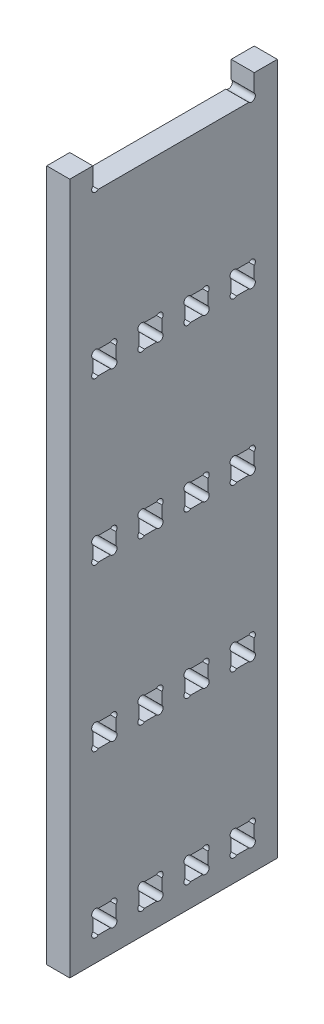
from build123d import *

# Parameters (mm, degrees)
BOSS_EXTRUDE1_DEPTH = 19.05


with BuildPart() as part:
    # Sketch8 → Boss-Extrude1 (new body)
    with BuildSketch(Plane(origin=(0, 0, 0), x_dir=(0, 0, -1), z_dir=(1, 0, 0))):
        with BuildLine():
            Line((0, -571.5), (0, 0))
            Line((0, 0), (-19.05, 0))
            Line((-19.05, 0), (-19.05, -14.559871939))
            ThreePointArc((-19.05, -14.559871939), (-19.05, -19.05), (-23.540128061, -19.05))
            Line((-23.540128061, -19.05), (-147.909871939, -19.05))
            ThreePointArc((-147.909871939, -19.05), (-152.4, -19.05), (-152.4, -14.559871939))
            Line((-152.4, -14.559871939), (-152.4, 0))
            Line((-152.4, 0), (-171.45, 0))
            Line((-171.45, 0), (-171.45, -571.5))
            Line((-171.45, -571.5), (0, -571.5))
        make_face()
        with BuildLine():
            Line((-152.4, -537.890128061), (-152.4, -547.959871939))
            ThreePointArc((-152.4, -547.959871939), (-152.4, -552.45), (-147.909871939, -552.45))
            Line((-147.909871939, -552.45), (-137.840128061, -552.45))
            ThreePointArc((-137.840128061, -552.45), (-133.35, -552.45), (-133.35, -547.959871939))
            Line((-133.35, -547.959871939), (-133.35, -537.890128061))
            ThreePointArc((-133.35, -537.890128061), (-133.35, -533.4), (-137.840128061, -533.4))
            Line((-137.840128061, -533.4), (-147.909871939, -533.4))
            ThreePointArc((-147.909871939, -533.4), (-152.4, -533.4), (-152.4, -537.890128061))
        make_face(mode=Mode.SUBTRACT)
        with BuildLine():
            Line((-114.3, -537.890128061), (-114.3, -547.959871939))
            ThreePointArc((-114.3, -547.959871939), (-114.3, -552.45), (-109.809871939, -552.45))
            Line((-109.809871939, -552.45), (-99.740128061, -552.45))
            ThreePointArc((-99.740128061, -552.45), (-95.25, -552.45), (-95.25, -547.959871939))
            Line((-95.25, -547.959871939), (-95.25, -537.890128061))
            ThreePointArc((-95.25, -537.890128061), (-95.25, -533.4), (-99.740128061, -533.4))
            Line((-99.740128061, -533.4), (-109.809871939, -533.4))
            ThreePointArc((-109.809871939, -533.4), (-114.3, -533.4), (-114.3, -537.890128061))
        make_face(mode=Mode.SUBTRACT)
        with BuildLine():
            Line((-76.2, -537.890128061), (-76.2, -547.959871939))
            ThreePointArc((-76.2, -547.959871939), (-76.2, -552.45), (-71.709871939, -552.45))
            Line((-71.709871939, -552.45), (-61.640128061, -552.45))
            ThreePointArc((-61.640128061, -552.45), (-57.15, -552.45), (-57.15, -547.959871939))
            Line((-57.15, -547.959871939), (-57.15, -537.890128061))
            ThreePointArc((-57.15, -537.890128061), (-57.15, -533.4), (-61.640128061, -533.4))
            Line((-61.640128061, -533.4), (-71.709871939, -533.4))
            ThreePointArc((-71.709871939, -533.4), (-76.2, -533.4), (-76.2, -537.890128061))
        make_face(mode=Mode.SUBTRACT)
        with BuildLine():
            Line((-38.1, -537.890128061), (-38.1, -547.959871939))
            ThreePointArc((-38.1, -547.959871939), (-38.1, -552.45), (-33.609871939, -552.45))
            Line((-33.609871939, -552.45), (-23.540128061, -552.45))
            ThreePointArc((-23.540128061, -552.45), (-19.05, -552.45), (-19.05, -547.959871939))
            Line((-19.05, -547.959871939), (-19.05, -537.890128061))
            ThreePointArc((-19.05, -537.890128061), (-19.05, -533.4), (-23.540128061, -533.4))
            Line((-23.540128061, -533.4), (-33.609871939, -533.4))
            ThreePointArc((-33.609871939, -533.4), (-38.1, -533.4), (-38.1, -537.890128061))
        make_face(mode=Mode.SUBTRACT)
        with BuildLine():
            Line((-114.3, -404.540128061), (-114.3, -414.609871939))
            ThreePointArc((-114.3, -414.609871939), (-114.3, -419.1), (-109.809871939, -419.1))
            Line((-109.809871939, -419.1), (-99.740128061, -419.1))
            ThreePointArc((-99.740128061, -419.1), (-95.25, -419.1), (-95.25, -414.609871939))
            Line((-95.25, -414.609871939), (-95.25, -404.540128061))
            ThreePointArc((-95.25, -404.540128061), (-95.25, -400.05), (-99.740128061, -400.05))
            Line((-99.740128061, -400.05), (-109.809871939, -400.05))
            ThreePointArc((-109.809871939, -400.05), (-114.3, -400.05), (-114.3, -404.540128061))
        make_face(mode=Mode.SUBTRACT)
        with BuildLine():
            Line((-76.2, -404.540128061), (-76.2, -414.609871939))
            ThreePointArc((-76.2, -414.609871939), (-76.2, -419.1), (-71.709871939, -419.1))
            Line((-71.709871939, -419.1), (-61.640128061, -419.1))
            ThreePointArc((-61.640128061, -419.1), (-57.15, -419.1), (-57.15, -414.609871939))
            Line((-57.15, -414.609871939), (-57.15, -404.540128061))
            ThreePointArc((-57.15, -404.540128061), (-57.15, -400.05), (-61.640128061, -400.05))
            Line((-61.640128061, -400.05), (-71.709871939, -400.05))
            ThreePointArc((-71.709871939, -400.05), (-76.2, -400.05), (-76.2, -404.540128061))
        make_face(mode=Mode.SUBTRACT)
        with BuildLine():
            Line((-38.1, -404.540128061), (-38.1, -414.609871939))
            ThreePointArc((-38.1, -414.609871939), (-38.1, -419.1), (-33.609871939, -419.1))
            Line((-33.609871939, -419.1), (-23.540128061, -419.1))
            ThreePointArc((-23.540128061, -419.1), (-19.05, -419.1), (-19.05, -414.609871939))
            Line((-19.05, -414.609871939), (-19.05, -404.540128061))
            ThreePointArc((-19.05, -404.540128061), (-19.05, -400.05), (-23.540128061, -400.05))
            Line((-23.540128061, -400.05), (-33.609871939, -400.05))
            ThreePointArc((-33.609871939, -400.05), (-38.1, -400.05), (-38.1, -404.540128061))
        make_face(mode=Mode.SUBTRACT)
        with BuildLine():
            Line((-114.3, -271.190128061), (-114.3, -281.259871939))
            ThreePointArc((-114.3, -281.259871939), (-114.3, -285.75), (-109.809871939, -285.75))
            Line((-109.809871939, -285.75), (-99.740128061, -285.75))
            ThreePointArc((-99.740128061, -285.75), (-95.25, -285.75), (-95.25, -281.259871939))
            Line((-95.25, -281.259871939), (-95.25, -271.190128061))
            ThreePointArc((-95.25, -271.190128061), (-95.25, -266.7), (-99.740128061, -266.7))
            Line((-99.740128061, -266.7), (-109.809871939, -266.7))
            ThreePointArc((-109.809871939, -266.7), (-114.3, -266.7), (-114.3, -271.190128061))
        make_face(mode=Mode.SUBTRACT)
        with BuildLine():
            Line((-76.2, -271.190128061), (-76.2, -281.259871939))
            ThreePointArc((-76.2, -281.259871939), (-76.2, -285.75), (-71.709871939, -285.75))
            Line((-71.709871939, -285.75), (-61.640128061, -285.75))
            ThreePointArc((-61.640128061, -285.75), (-57.15, -285.75), (-57.15, -281.259871939))
            Line((-57.15, -281.259871939), (-57.15, -271.190128061))
            ThreePointArc((-57.15, -271.190128061), (-57.15, -266.7), (-61.640128061, -266.7))
            Line((-61.640128061, -266.7), (-71.709871939, -266.7))
            ThreePointArc((-71.709871939, -266.7), (-76.2, -266.7), (-76.2, -271.190128061))
        make_face(mode=Mode.SUBTRACT)
        with BuildLine():
            Line((-38.1, -271.190128061), (-38.1, -281.259871939))
            ThreePointArc((-38.1, -281.259871939), (-38.1, -285.75), (-33.609871939, -285.75))
            Line((-33.609871939, -285.75), (-23.540128061, -285.75))
            ThreePointArc((-23.540128061, -285.75), (-19.05, -285.75), (-19.05, -281.259871939))
            Line((-19.05, -281.259871939), (-19.05, -271.190128061))
            ThreePointArc((-19.05, -271.190128061), (-19.05, -266.7), (-23.540128061, -266.7))
            Line((-23.540128061, -266.7), (-33.609871939, -266.7))
            ThreePointArc((-33.609871939, -266.7), (-38.1, -266.7), (-38.1, -271.190128061))
        make_face(mode=Mode.SUBTRACT)
        with BuildLine():
            Line((-114.3, -137.840128061), (-114.3, -147.909871939))
            ThreePointArc((-114.3, -147.909871939), (-114.3, -152.4), (-109.809871939, -152.4))
            Line((-109.809871939, -152.4), (-99.740128061, -152.4))
            ThreePointArc((-99.740128061, -152.4), (-95.25, -152.4), (-95.25, -147.909871939))
            Line((-95.25, -147.909871939), (-95.25, -137.840128061))
            ThreePointArc((-95.25, -137.840128061), (-95.25, -133.35), (-99.740128061, -133.35))
            Line((-99.740128061, -133.35), (-109.809871939, -133.35))
            ThreePointArc((-109.809871939, -133.35), (-114.3, -133.35), (-114.3, -137.840128061))
        make_face(mode=Mode.SUBTRACT)
        with BuildLine():
            Line((-76.2, -137.840128061), (-76.2, -147.909871939))
            ThreePointArc((-76.2, -147.909871939), (-76.2, -152.4), (-71.709871939, -152.4))
            Line((-71.709871939, -152.4), (-61.640128061, -152.4))
            ThreePointArc((-61.640128061, -152.4), (-57.15, -152.4), (-57.15, -147.909871939))
            Line((-57.15, -147.909871939), (-57.15, -137.840128061))
            ThreePointArc((-57.15, -137.840128061), (-57.15, -133.35), (-61.640128061, -133.35))
            Line((-61.640128061, -133.35), (-71.709871939, -133.35))
            ThreePointArc((-71.709871939, -133.35), (-76.2, -133.35), (-76.2, -137.840128061))
        make_face(mode=Mode.SUBTRACT)
        with BuildLine():
            Line((-38.1, -137.840128061), (-38.1, -147.909871939))
            ThreePointArc((-38.1, -147.909871939), (-38.1, -152.4), (-33.609871939, -152.4))
            Line((-33.609871939, -152.4), (-23.540128061, -152.4))
            ThreePointArc((-23.540128061, -152.4), (-19.05, -152.4), (-19.05, -147.909871939))
            Line((-19.05, -147.909871939), (-19.05, -137.840128061))
            ThreePointArc((-19.05, -137.840128061), (-19.05, -133.35), (-23.540128061, -133.35))
            Line((-23.540128061, -133.35), (-33.609871939, -133.35))
            ThreePointArc((-33.609871939, -133.35), (-38.1, -133.35), (-38.1, -137.840128061))
        make_face(mode=Mode.SUBTRACT)
        with BuildLine():
            Line((-152.4, -404.540128061), (-152.4, -414.609871939))
            ThreePointArc((-152.4, -414.609871939), (-152.4, -419.1), (-147.909871939, -419.1))
            Line((-147.909871939, -419.1), (-137.840128061, -419.1))
            ThreePointArc((-137.840128061, -419.1), (-133.35, -419.1), (-133.35, -414.609871939))
            Line((-133.35, -414.609871939), (-133.35, -404.540128061))
            ThreePointArc((-133.35, -404.540128061), (-133.35, -400.05), (-137.840128061, -400.05))
            Line((-137.840128061, -400.05), (-147.909871939, -400.05))
            ThreePointArc((-147.909871939, -400.05), (-152.4, -400.05), (-152.4, -404.540128061))
        make_face(mode=Mode.SUBTRACT)
        with BuildLine():
            Line((-152.4, -271.190128061), (-152.4, -281.259871939))
            ThreePointArc((-152.4, -281.259871939), (-152.4, -285.75), (-147.909871939, -285.75))
            Line((-147.909871939, -285.75), (-137.840128061, -285.75))
            ThreePointArc((-137.840128061, -285.75), (-133.35, -285.75), (-133.35, -281.259871939))
            Line((-133.35, -281.259871939), (-133.35, -271.190128061))
            ThreePointArc((-133.35, -271.190128061), (-133.35, -266.7), (-137.840128061, -266.7))
            Line((-137.840128061, -266.7), (-147.909871939, -266.7))
            ThreePointArc((-147.909871939, -266.7), (-152.4, -266.7), (-152.4, -271.190128061))
        make_face(mode=Mode.SUBTRACT)
        with BuildLine():
            Line((-152.4, -137.840128061), (-152.4, -147.909871939))
            ThreePointArc((-152.4, -147.909871939), (-152.4, -152.4), (-147.909871939, -152.4))
            Line((-147.909871939, -152.4), (-137.840128061, -152.4))
            ThreePointArc((-137.840128061, -152.4), (-133.35, -152.4), (-133.35, -147.909871939))
            Line((-133.35, -147.909871939), (-133.35, -137.840128061))
            ThreePointArc((-133.35, -137.840128061), (-133.35, -133.35), (-137.840128061, -133.35))
            Line((-137.840128061, -133.35), (-147.909871939, -133.35))
            ThreePointArc((-147.909871939, -133.35), (-152.4, -133.35), (-152.4, -137.840128061))
        make_face(mode=Mode.SUBTRACT)
    extrude(amount=BOSS_EXTRUDE1_DEPTH)


solid = part.part
